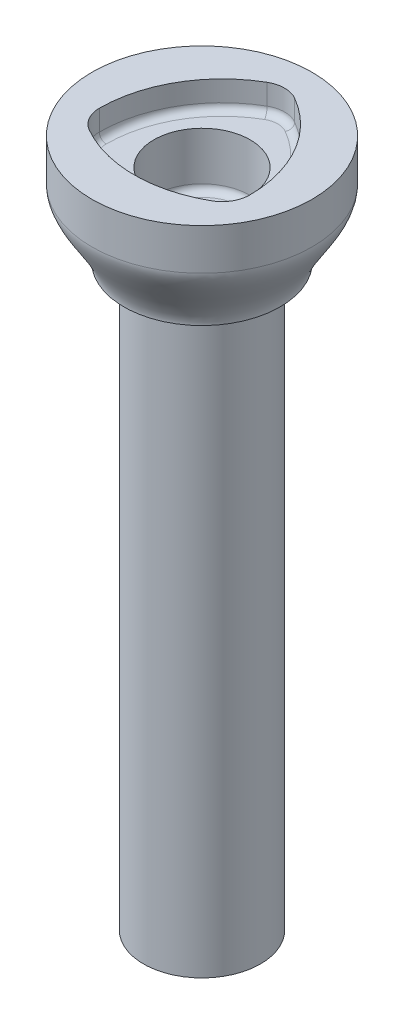
from build123d import *

# Parameters (mm, degrees)
CUT_EXTRUDE1_DEPTH = 4
SKETCH8_R          = 7
CUT_EXTRUDE2_DEPTH = 8
FILLET1_R          = 1


with BuildPart() as part:
    # Sketch6 → Revolve1 (revolve)
    with BuildSketch(Plane.XY):
        with BuildLine():
            Line((0, 0), (-8.5, 0))
            Line((-8.5, 0), (-8.5, 84.13))
            Line((-8.5, 84.13), (-11.35, 84.13))
            add(Edge.make_bspline(
                [(-16, 94), (-16, 91.39), (-11.35, 86.74), (-11.35, 84.13)],
                knots=[0, 0, 0, 0, 1, 1, 1, 1], degree=3))
            Line((-16, 94), (-16, 100))
            Line((-16, 100), (0, 100))
            Line((0, 100), (0, 0))
        make_face()
    revolve(axis=Axis((0, 0, 0), (0, 1, 0)))

    # Sketch7 → Cut-Extrude1 (cut)
    with BuildSketch(Plane(origin=(0, 100, 0), x_dir=(1, 0, 0), z_dir=(0, 1, 0))):
        with BuildLine():
            ThreePointArc((-2, 11.464101615), (0, 12), (2, 11.464101615))
            ThreePointArc((2, 11.464101615), (8.535898385, 4.92820323), (10.92820323, -4))
            ThreePointArc((10.92820323, -4), (10.392304845, -6), (8.92820323, -7.464101615))
            ThreePointArc((8.92820323, -7.464101615), (0, -9.856406461), (-8.92820323, -7.464101615))
            ThreePointArc((-8.92820323, -7.464101615), (-10.392304845, -6), (-10.92820323, -4))
            ThreePointArc((-10.92820323, -4), (-8.535898385, 4.92820323), (-2, 11.464101615))
        make_face()
    extrude(amount=-CUT_EXTRUDE1_DEPTH, mode=Mode.SUBTRACT)

    # Sketch8 → Cut-Extrude2 (cut)
    with BuildSketch(Plane(origin=(0, 96, 0), x_dir=(1, 0, 0), z_dir=(0, 1, 0))):
        Circle(SKETCH8_R)
    extrude(amount=-CUT_EXTRUDE2_DEPTH, mode=Mode.SUBTRACT)

    # Fillet1
    fillet1_edges = [part.edges().sort_by_distance(p)[0] for p in [
        (-10.392304845, 96, 6),
        (-8.535898385, 96, -4.92820323),
        (0, 96, -12),
        (8.535898385, 96, -4.92820323),
        (10.392304845, 96, 6),
        (-7, 88, 0),
        (0, 96, 9.856406461),
    ]]
    fillet(fillet1_edges, radius=FILLET1_R)


solid = part.part
